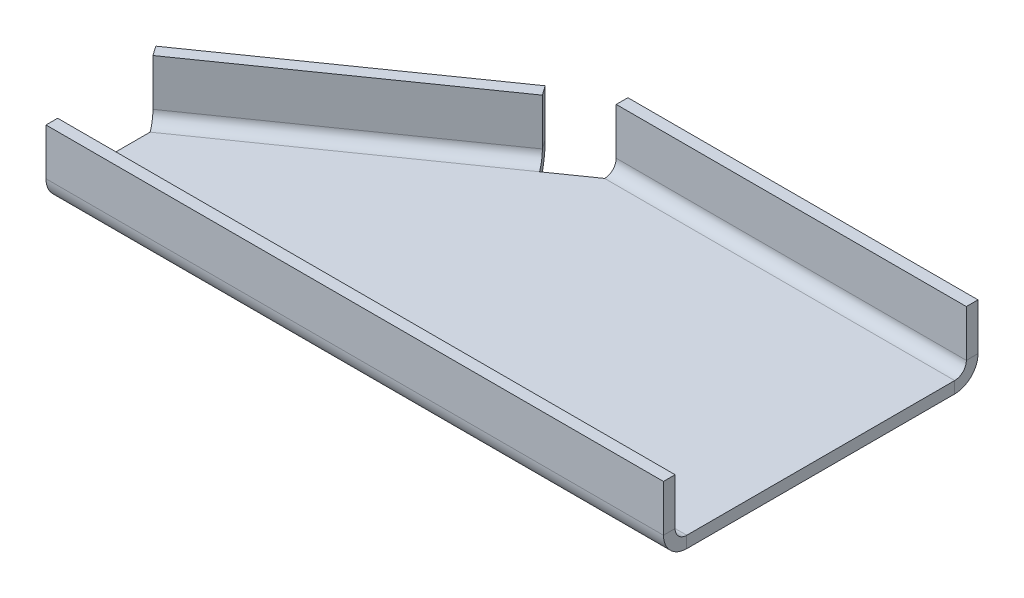
from build123d import *

# Parameters (mm, degrees)
BASE_FLANGE1_DEPTH        = 3.175
EDGE_FLANGE1_DEPTH        = 95.421779032
EDGE_FLANGE1_BEND_DEPTH   = 168.275
EDGE_FLANGE1_BEND_2_DEPTH = 76.2


# Sheet-metal steps are written as plain solids
with BuildPart() as part:
    # Sketch1 → Base-Flange1 (new body)
    with BuildSketch(Plane(origin=(0, 0, 0), x_dir=(1, 0, 0), z_dir=(0, 1, 0))):
        Polygon((168.275, 79.375), (72.853220968, 79.375), (0, 28.362625496), (0, 6.35), (168.275, 6.35), align=None)
    extrude(amount=-BASE_FLANGE1_DEPTH)

    # Edge-Flange1 section (across the edge) → Edge-Flange1 (add)
    with BuildSketch(Plane(origin=(168.275, 0, -82.55), x_dir=(0, 0, 1), z_dir=(-1, 0, 0))):
        with BuildLine():
            Line((-3.175, 3.175), (-3.175, 15.875))
            Line((-3.175, 15.875), (0, 15.875))
            Line((0, 15.875), (0, 3.175))
            ThreePointArc((0, 3.175), (0.92993597, 0.92993597), (3.175, 0))
            Line((3.175, 0), (3.175, -3.175))
            ThreePointArc((3.175, -3.175), (-1.315128061, -1.315128061), (-3.175, 3.175))
        make_face()
    extrude(amount=EDGE_FLANGE1_DEPTH)

    # Edge-Flange1 section 2 (across the edge) → Edge-Flange1 bend (add)
    with BuildSketch(Plane(origin=(0, 0, -3.175), x_dir=(0, 0, -1), z_dir=(1, 0, 0))):
        with BuildLine():
            Line((-3.175, 3.175), (-3.175, 15.875))
            Line((-3.175, 15.875), (0, 15.875))
            Line((0, 15.875), (0, 3.175))
            ThreePointArc((0, 3.175), (0.92993597, 0.92993597), (3.175, 0))
            Line((3.175, 0), (3.175, -3.175))
            ThreePointArc((3.175, -3.175), (-1.315128061, -1.315128061), (-3.175, 3.175))
        make_face()
    extrude(amount=EDGE_FLANGE1_BEND_DEPTH)

    # Edge-Flange1 section 3 (across the edge) → Edge-Flange1 bend 2 (add)
    with BuildSketch(Plane(origin=(60.598280589, 0, -74.669957686), x_dir=(0.5735764363510473, 3.491481338843133e-15, 0.819152044288991), z_dir=(-0.819152044288991, 0, 0.5735764363510473))):
        with BuildLine():
            Line((-3.175, 3.175), (-3.175, 15.875))
            Line((-3.175, 15.875), (0, 15.875))
            Line((0, 15.875), (0, 3.175))
            ThreePointArc((0, 3.175), (0.92993597, 0.92993597), (3.175, 0))
            Line((3.175, 0), (3.175, -3.175))
            ThreePointArc((3.175, -3.175), (-1.315128061, -1.315128061), (-3.175, 3.175))
        make_face()
    extrude(amount=EDGE_FLANGE1_BEND_2_DEPTH)


solid = part.part
